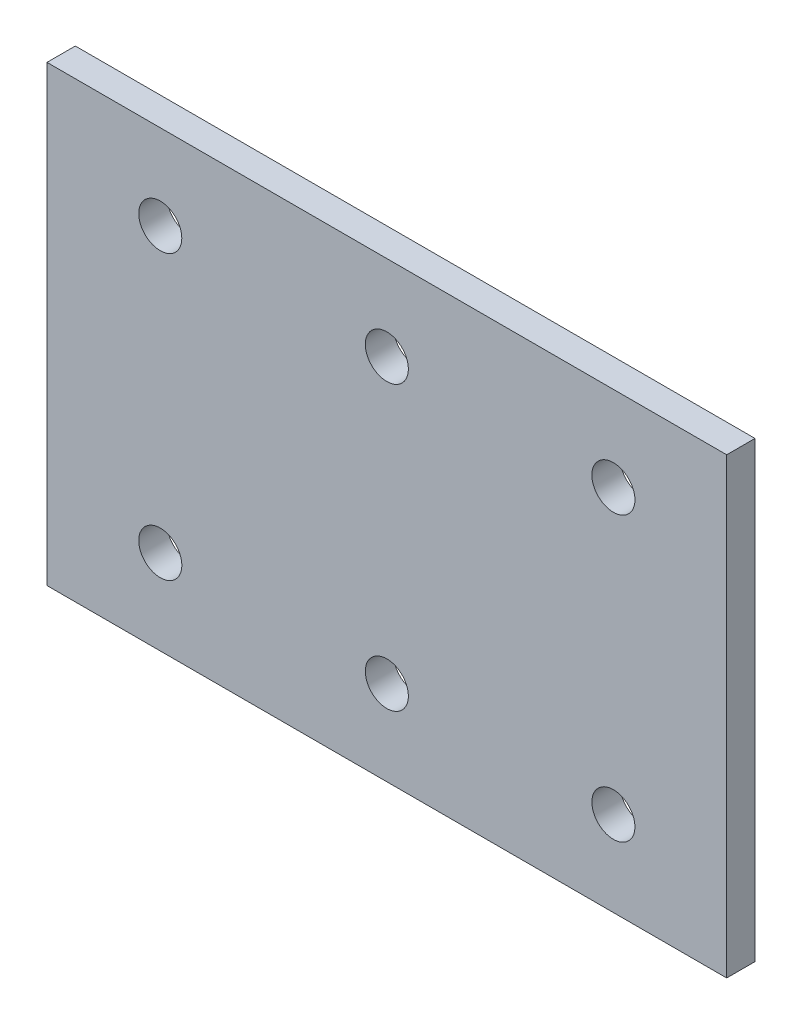
from build123d import *

# Parameters (mm, degrees)
SKETCH1_W           = 76.2
SKETCH1_H           = 50.8
SKETCH1_R           = 2.413
BOSS_EXTRUDE1_DEPTH = 3.175


with BuildPart() as part:
    # Sketch1 → Boss-Extrude1 (new body)
    with BuildSketch(Plane.XY):
        with Locations((38.1, 25.4)):
            Rectangle(SKETCH1_W, SKETCH1_H)
        with Locations((12.7, 41.275)):
            Circle(SKETCH1_R, mode=Mode.SUBTRACT)
        with Locations((38.1, 41.275)):
            Circle(SKETCH1_R, mode=Mode.SUBTRACT)
        with Locations((63.5, 41.275)):
            Circle(SKETCH1_R, mode=Mode.SUBTRACT)
        with Locations((63.5, 9.525)):
            Circle(SKETCH1_R, mode=Mode.SUBTRACT)
        with Locations((38.1, 9.525)):
            Circle(SKETCH1_R, mode=Mode.SUBTRACT)
        with Locations((12.7, 9.525)):
            Circle(SKETCH1_R, mode=Mode.SUBTRACT)
    extrude(amount=BOSS_EXTRUDE1_DEPTH)


solid = part.part
